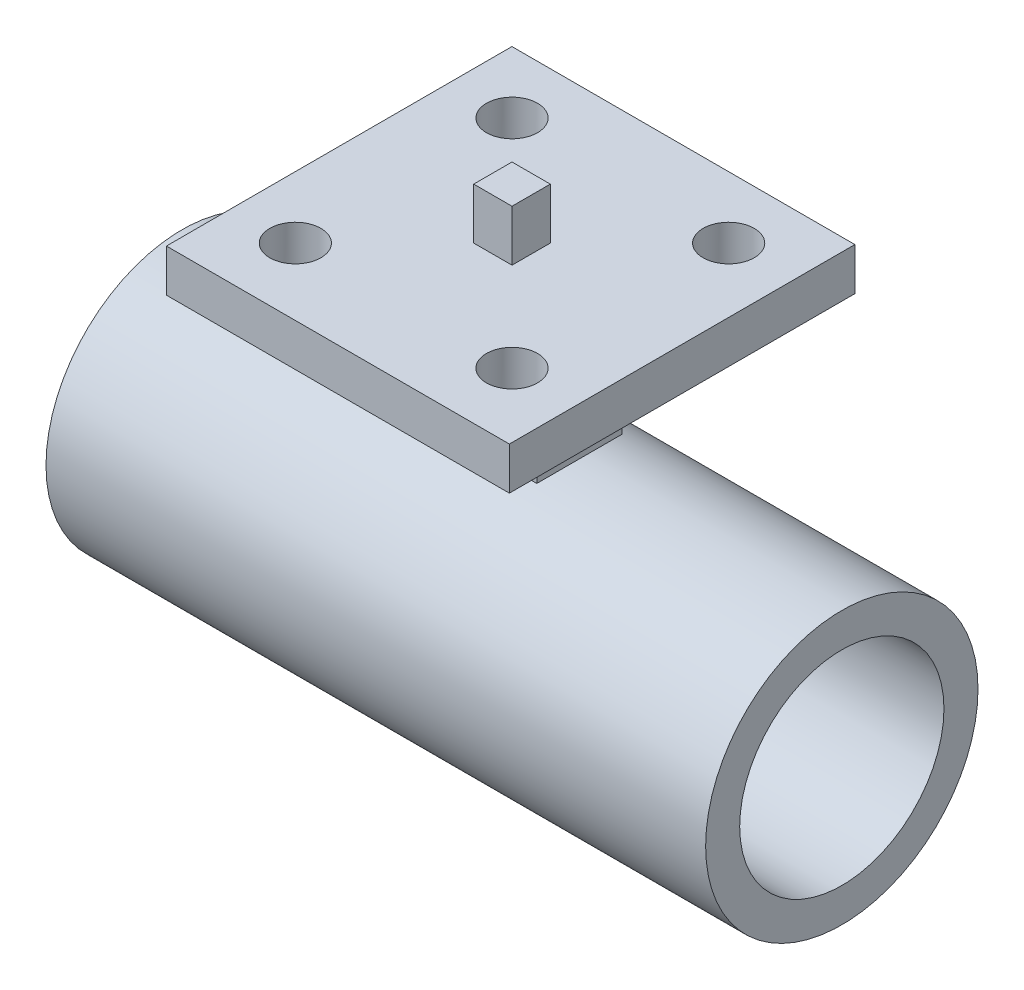
from build123d import *

# Parameters (mm, degrees)
DODANIE_WYCI_GNI_CIE1_DEPTH      = 16
DODANIE_WYCI_GNI_CIE1_DEPTH_BACK = 16
SZKIC2_R                         = 3
WYTNIJ_WYCI_GNI_CIE1_DEPTH       = 15
DODANIE_WYCI_GNI_CIE2_DEPTH      = 6
SZKIC5_W                         = 15.832735356
SZKIC5_H                         = 13
WYTNIJ_WYCI_GNI_CIE2_DEPTH       = 11
SZKIC6_W                         = 15.832735356
SZKIC6_H                         = 13
WYTNIJ_WYCI_GNI_CIE3_DEPTH       = 11
SZKIC7_W                         = 40.29170114
SZKIC7_H                         = 40.594635428
SZKIC7_W_2                       = 32
SZKIC7_H_2                       = 32
DODANIE_WYCI_GNI_CIE3_DEPTH      = 5


with BuildPart() as part:
    # Szkic1 → Dodanie-wyciągnięcie1 (new, two sides: drawn at the far end of the back side and taken through both)
    with BuildSketch(Plane.XY.offset(-DODANIE_WYCI_GNI_CIE1_DEPTH_BACK)):
        Polygon((30.833632322, 16), (46.666367678, 16), (46.666367678, 29), (54.75, 29), (54.75, 34), (22.75, 34), (22.75, 29), (30.833632322, 29), align=None)
    extrude(amount=DODANIE_WYCI_GNI_CIE1_DEPTH + DODANIE_WYCI_GNI_CIE1_DEPTH_BACK)

    # Szkic2 → Wytnij-wyciągnięcie1 (cut)
    with BuildSketch(Plane(origin=(0, 34, 0), x_dir=(1, 0, 0), z_dir=(0, 1, 0))):
        with Locations((51.477922061, 12.727922061)):
            Circle(SZKIC2_R)
        with Locations((26.022077939, 12.727922061)):
            Circle(SZKIC2_R)
        with Locations((51.477922061, -12.727922061)):
            Circle(SZKIC2_R)
        with Locations((26.022077939, -12.727922061)):
            Circle(SZKIC2_R)
    extrude(amount=-WYTNIJ_WYCI_GNI_CIE1_DEPTH, mode=Mode.SUBTRACT)

    # Szkic3 → Dodanie-wyciągnięcie2 (add)
    with BuildSketch(Plane(origin=(0, 34, 0), x_dir=(1, 0, 0), z_dir=(0, 1, 0))):
        Polygon((36.500021314, 2.249743185), (36.500021314, -2.249743185), (40.999978686, -2.249743185), (40.999978686, 2.249743185), (38.75, 2.249743185), align=None)
    extrude(amount=DODANIE_WYCI_GNI_CIE2_DEPTH)

    # Szkic5 → Wytnij-wyciągnięcie2 (cut)
    with BuildSketch(Plane.XY.offset(16)):
        with Locations((38.75, 22.5)):
            Rectangle(SZKIC5_W, SZKIC5_H)
    extrude(amount=-WYTNIJ_WYCI_GNI_CIE2_DEPTH, mode=Mode.SUBTRACT)

    # Szkic6 → Wytnij-wyciągnięcie3 (cut)
    with BuildSketch(Plane(origin=(0, 0, -16), x_dir=(-1, 0, 0), z_dir=(0, 0, -1))):
        with Locations((-38.75, 22.5)):
            Rectangle(SZKIC6_W, SZKIC6_H)
    extrude(amount=-WYTNIJ_WYCI_GNI_CIE3_DEPTH, mode=Mode.SUBTRACT)

    # Szkic7 → Dodanie-wyciągnięcie3 (add)
    with BuildSketch(Plane(origin=(0, 34, 0), x_dir=(1, 0, 0), z_dir=(0, 1, 0))):
        with Locations((38.89571093, -0.304852178)):
            Rectangle(SZKIC7_W, SZKIC7_H)
        with Locations((38.75, 0)):
            Rectangle(SZKIC7_W_2, SZKIC7_H_2, mode=Mode.SUBTRACT)
    extrude(amount=-DODANIE_WYCI_GNI_CIE3_DEPTH)


with BuildPart() as body_2:
    # Szkic4 → Obrót2 (revolve)
    with BuildSketch(Plane.XY):
        Polygon((0, 16), (0, 12), (77.5, 12), (77.5, 16), (46.666367678, 16), (30.833632322, 16), align=None)
    revolve(axis=Axis((0, 0, 0), (1, 0, 0)))


solid = Compound([part.part, body_2.part])
